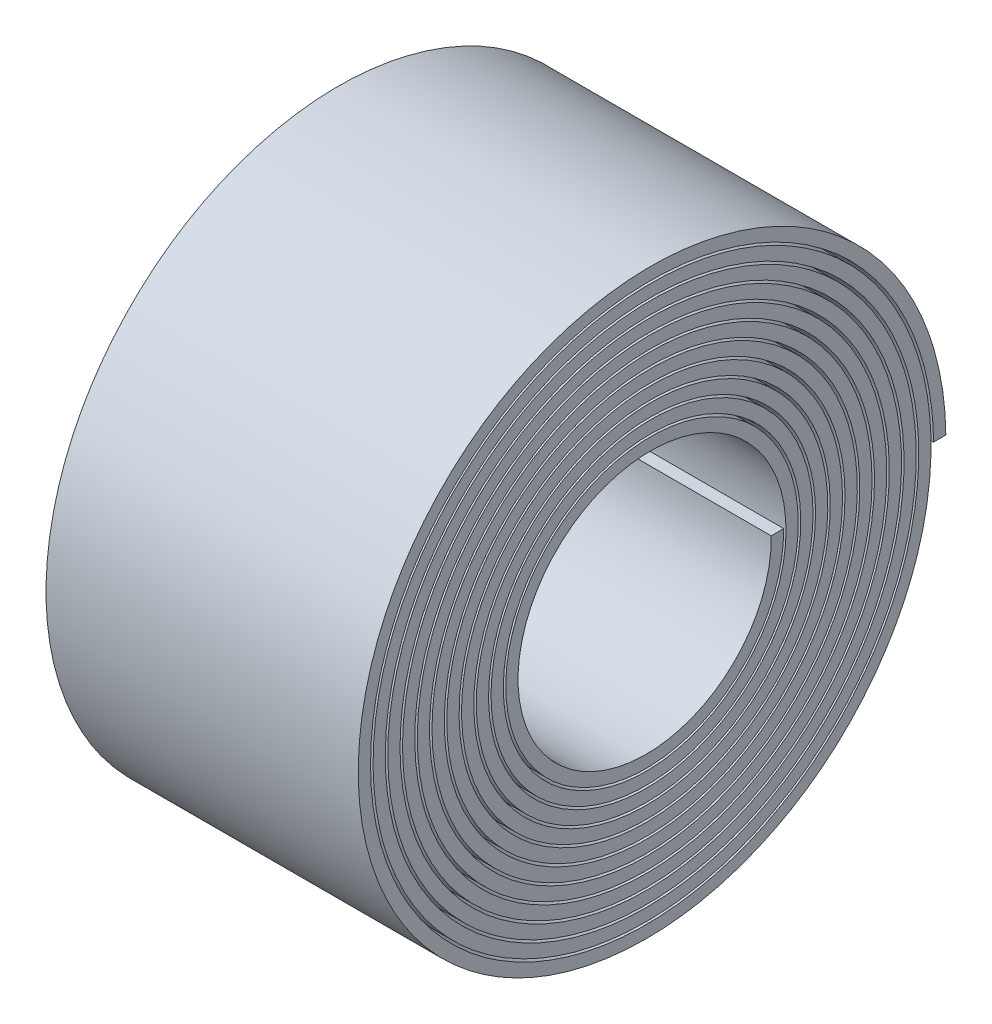
from build123d import *

# Parameters (mm, degrees)
BOSS_EXTRUDE1_DEPTH = 3.175


with BuildPart() as part:
    # Sketch2 → Boss-Extrude1 (new, symmetric)
    with BuildSketch(Plane(origin=(0, 0, 0), x_dir=(0, 0, -1), z_dir=(1, 0, 0))):
        with BuildLine():
            Line((2.5, 0), (2.749954418, 0.004773778))
            add(Edge.make_bspline(
                [(2.749954418, 0.004773778), (2.759336951, -0.48649449), (2.504441518, -1.49123814), (1.394996425, -2.588690616), (-0.135916177, -2.965083795), (-1.655956227, -2.495708999), (-2.727914335, -1.300873713), (-3.035519366, 0.28933995), (-2.476614565, 1.824900774), (-1.196392731, 2.863526826), (0.449981164, 3.097963521), (1.995836502, 2.446770063), (2.995274656, 1.081678084), (3.151763663, -0.617413361), (2.405970813, -2.168109448), (0.956857528, -3.122477136), (-0.791164244, -3.196405729), (-2.341050362, -2.354019812), (-3.244457235, -0.822109443), (-3.231401579, 0.970729687), (-2.290759689, 2.513973532), (-0.677654466, 3.360545026), (1.155572943, 3.256290861), (2.686179686, 2.216073833), (3.470080052, 0.523755196), (3.270643075, -1.345126187), (2.129887327, -2.856958359), (0.360715774, -3.572413849), (-1.538792178, -3.274059512), (-3.025590321, -2.032167742), (-3.666912438, -0.188881321), (-3.2661751, 1.735946036), (-1.922925808, 3.191350059), (-0.008637217, 3.75295879), (1.935937129, 3.24666015), (3.35350829, 1.802215927), (3.829955261, -0.179591752), (3.215221994, -2.138091067), (1.670136557, -3.511334524), (-0.37534239, -3.89732597), (-2.341711784, -3.171606518), (-3.664099638, -1.526830437), (-3.954519139, 0.578114232), (-3.11559957, 2.546083725), (-1.372484672, 3.811078479), (0.787370812, 4.001009357), (2.750474108, 3.047028251), (3.951552473, 1.207330669), (4.036299789, -1.002541074), (2.965762075, -2.954135271), (1.031643916, -4.084812236), (-1.223020906, -4.0599243), (-3.156307086, -2.871714002), (-4.210160179, -0.845743621), (-4.071449499, 1.448174798), (-2.76484133, 3.356219443), (-0.649992191, 4.326913095), (1.677337625, 4.070476695), (3.553094782, 2.64514645), (4.434404729, 0.444794572), (4.05664375, -1.909816545), (2.512677458, -3.746150688), (0.230597435, -4.531988309), (-2.144893002, -4.029626836), (-3.934602507, -2.367528618), (-4.619039038, -0.007888212), (-3.989142073, 2.381824844), (-2.209840682, 4.117666018), (0.222806, 4.694956546), (2.619848529, 3.934947059), (4.294560109, 2.039801055), (4.75916727, -0.460919691), (3.866842273, -2.85818143), (1.857643808, -4.464509483), (-0.705850321, -4.811126786), (-3.096024222, -3.784672353), (-4.626747366, -1.663649539), (-4.850322054, 0.956959836), (-3.688327241, 3.332563352), (-1.458145082, 4.780518217), (1.213576324, 4.876273595), (3.566973576, 3.577743191), (4.925080422, 1.241503056), (4.888537569, -1.474995794), (3.452903638, -3.798420564), (1.014141266, -5.05970898), (-1.740484073, -4.886707769), (-4.026063556, -3.313839921), (-5.183698158, -0.776521949), (-4.870417504, 2.009278831), (-3.160631856, 4.249058072), (-0.529150866, 5.296364106), (2.280591709, 4.839341379), (4.466558659, 2.993408159), (5.397047434, 0.272576245), (4.793196957, -2.553610557), (2.812346721, -4.677721669), (0.007387578, -5.485115738), (-2.827501773, -4.731746305), (-4.881708061, -2.617674715), (-5.55996606, 0.265785729), (-4.654797401, 3.101412732), (-2.40966856, 5.077686219), (0.546275853, 5.621027285), (3.374474307, 4.562205424), (5.264834777, 2.188653714), (5.667762455, -0.83337818), (4.453873895, -3.645803464), (1.95500432, -5.442345433), (-1.126353075, -5.699671007), (-3.914505933, -4.329755682), (-5.609425763, -1.709142681), (-5.716290907, 1.424427775), (-4.189853854, 4.179678939), (-1.451538586, 5.765302005), (1.726798416, 5.717200699), (4.440413996, 4.034222389), (5.909221822, 1.182708467), (5.702021434, -2.03263216), (3.862966725, -4.69579979), (0.903214427, -6.04045683), (-2.341069512, -5.670419181), (-4.94492483, -3.676241592), (-6.158306134, -0.613672639), (-5.62210354, 2.651262328), (-3.474263132, 5.186747355), (-0.314707707, 6.262595306), (2.962210801, 5.554976753), (5.420715824, 3.264222479), (6.041154731, 1.075507272), (6.049991529, 0.002057968)],
                knots=[0, 0, 0, 0, 0.0078125, 0.015625, 0.0234375, 0.03125, 0.0390625, 0.046875, 0.0546875, 0.0625, 0.0703125, 0.078125, 0.0859375, 0.09375, 0.1015625, 0.109375, 0.1171875, 0.125, 0.1328125, 0.140625, 0.1484375, 0.15625, 0.1640625, 0.171875, 0.1796875, 0.1875, 0.1953125, 0.203125, 0.2109375, 0.21875, 0.2265625, 0.234375, 0.2421875, 0.25, 0.2578125, 0.265625, 0.2734375, 0.28125, 0.2890625, 0.296875, 0.3046875, 0.3125, 0.3203125, 0.328125, 0.3359375, 0.34375, 0.3515625, 0.359375, 0.3671875, 0.375, 0.3828125, 0.390625, 0.3984375, 0.40625, 0.4140625, 0.421875, 0.4296875, 0.4375, 0.4453125, 0.453125, 0.4609375, 0.46875, 0.4765625, 0.484375, 0.4921875, 0.5, 0.5078125, 0.515625, 0.5234375, 0.53125, 0.5390625, 0.546875, 0.5546875, 0.5625, 0.5703125, 0.578125, 0.5859375, 0.59375, 0.6015625, 0.609375, 0.6171875, 0.625, 0.6328125, 0.640625, 0.6484375, 0.65625, 0.6640625, 0.671875, 0.6796875, 0.6875, 0.6953125, 0.703125, 0.7109375, 0.71875, 0.7265625, 0.734375, 0.7421875, 0.75, 0.7578125, 0.765625, 0.7734375, 0.78125, 0.7890625, 0.796875, 0.8046875, 0.8125, 0.8203125, 0.828125, 0.8359375, 0.84375, 0.8515625, 0.859375, 0.8671875, 0.875, 0.8828125, 0.890625, 0.8984375, 0.90625, 0.9140625, 0.921875, 0.9296875, 0.9375, 0.9453125, 0.953125, 0.9609375, 0.96875, 0.9765625, 0.984375, 0.9921875, 1, 1, 1, 1], degree=3))
            Line((6.049991529, 0.002057968), (5.8, 0))
            add(Edge.make_bspline(
                [(2.5, 0), (2.50859375, -0.449967698), (2.392778951, -0.904162722), (1.940090731, -1.692859421), (1.603767996, -2.026210074), (0.801828477, -2.474344378), (0.337287211, -2.588417762), (-0.590215738, -2.560060692), (-1.051876817, -2.417574583), (-1.840560709, -1.911264086), (-2.166428561, -1.548067808), (-2.586577644, -0.699936707), (-2.680185601, -0.216146124), (-2.603623307, 0.736555878), (-2.433465098, 1.204126814), (-1.872480277, 1.989379926), (-1.482360865, 2.305908109), (-0.588913213, 2.69458986), (-0.08679681, 2.766112225), (0.888541293, 2.638810049), (1.360386236, 2.440069018), (2.138689222, 1.823566764), (2.443999289, 1.406593191), (2.797753061, 0.46893579), (2.845612679, -0.050470062), (2.665174615, -1.045693685), (2.437035486, -1.520102303), (1.764388942, -2.287846833), (1.320750679, -2.580045979), (0.340221958, -2.895447005), (-0.195326178, -2.918116917), (-1.207504704, -2.682297896), (-1.682697681, -2.424045921), (-2.436199319, -1.694851079), (-2.713387723, -1.224859604), (-2.987061564, -0.203028609), (-2.983072087, 0.347406368), (-2.689789841, 1.373437484), (-2.400815567, 1.847572344), (-1.614897121, 2.583083839), (-1.118986989, 2.843362124), (-0.057651516, 3.071999099), (0.506309518, 3.039944774), (1.542928293, 2.687291235), (2.014105516, 2.367094939), (2.727830484, 1.524511364), (2.969307263, 1.003240842), (3.149676804, -0.095575298), (3.088223193, -0.671599626), (2.674475391, -1.715388283), (2.322671166, -2.181657707), (1.423718991, -2.869764659), (0.877770249, -3.090564131), (-0.256280318, -3.219529026), (-0.842806976, -3.127419324), (-1.890205347, -2.651049735), (-2.349572831, -2.267369207), (-3.008209483, -1.312586482), (-3.206479077, -0.742765327), (-3.281009534, 0.424055448), (-3.157070986, 1.019429447), (-2.616757292, 2.066746065), (-2.201052955, 2.517180389), (-1.191221871, 3.142488237), (-0.598457038, 3.31640625), (0.598457038, 3.33359375), (1.200933931, 3.176743831), (2.244357741, 2.571378057), (2.683797727, 2.12362621), (3.271926812, 1.059774878), (3.41971004, 0.445116858), (3.376780916, -0.779007048), (3.186033271, -1.386757885), (2.514730258, -2.422370525), (2.035033534, -2.848732354), (0.918436885, -3.395856184), (0.283056306, -3.515767501), (-0.965194342, -3.410096206), (-1.576310983, -3.184566309), (-2.600099609, -2.446671494), (-3.011284313, -1.935260959), (-3.513614885, -0.767440782), (-3.603970757, -0.112626336), (-3.433092758, 1.156476102), (-3.172003282, 1.768976884), (-2.367099748, 2.776847493), (-1.824336577, 3.170748591), (-0.607060662, 3.624551467), (0.065783418, 3.683729369), (1.35227936, 3.445353638), (1.964115097, 3.148039511), (2.951906315, 2.275954274), (3.326417576, 1.702330977), (3.728026962, 0.437611378), (3.754472668, -0.251745526), (3.446493714, -1.552002653), (3.112406835, -2.161062956), (2.173216354, -3.124560233), (1.569357553, -3.47758354), (0.259447957, -3.823417314), (-0.444795788, -3.815652044), (-1.755017782, -3.436161437), (-2.359137676, -3.064875048), (-3.294087863, -2.058909915), (-3.623541147, -1.425572664), (-3.910115788, -0.072964872), (-3.86674318, 0.64443439), (-3.414040536, 1.960671679), (-3.005253211, 2.557638499), (-1.933102011, 3.459764748), (-1.271175651, 3.763589972), (0.121404823, 3.987535336), (0.850127195, 3.907248218), (2.168288377, 3.379851595), (2.755848924, 2.933390849), (3.620865869, 1.795903161), (3.89703703, 1.106408713), (4.055110926, -0.323190501), (3.936697865, -1.061307155), (3.333353528, -2.377171073), (2.849179024, -2.953039004), (1.64746755, -3.776668171), (0.931556637, -4.023199302), (-0.531885095, -4.112301812), (-1.277375848, -3.954653419), (-2.586604279, -3.274344944), (-3.148467714, -2.752551274), (-3.926453117, -1.48799308), (-4.14140625, -0.746946378), (-4.15859375, 0.746946378), (-3.960708712, 1.497705139), (-3.202665383, 2.79585606), (-2.643484425, 3.341385379), (-1.317721279, 4.069509245), (-0.552946505, 4.251002317), (0.967798358, 4.193501141), (1.721638953, 3.954491958), (3.004180341, 3.118196431), (3.531036148, 2.521999259), (4.205134725, 1.136937064), (4.351349401, 0.349966489), (4.216569105, -1.193832807), (3.935667519, -1.948495153), (3.020862711, -3.210819292), (2.388161053, -3.716660517), (0.945968352, -4.33263991), (0.138455862, -4.441829289), (-1.424410911, -4.227375468), (-2.177567531, -3.903937546), (-3.415005765, -2.910632731), (-3.897497893, -2.242079963), (-4.451349873, -0.745185534), (-4.521846058, 0.081096774), (-4.225532661, 1.658865035), (-3.859043536, 2.408127891), (-2.787519606, 3.615965796), (-2.083911275, 4.072789173), (-0.535000798, 4.560606919), (0.308164873, 4.590828418), (1.49941667, 4.305724253), (1.884131855, 4.156627271), (2.600856618, 3.760484593), (2.93280146, 3.513471219), (3.519547918, 2.938878159), (3.774295618, 2.611347035), (4.187680107, 1.899056501), (4.346277784, 1.514358453), (4.555274638, 0.715364354), (4.605652435, 0.301138071), (4.593919741, -0.526974892), (4.53180726, -0.940788425), (4.298957776, -1.737994862), (4.128238423, -2.12131654), (3.689957264, -2.829501279), (3.422431574, -3.154300228), (2.809425664, -3.721494668), (2.463997503, -3.963837864), (1.719846675, -4.348032957), (1.321188311, -4.489848247), (0.499248256, -4.662104401), (0.076038503, -4.692527095), (-0.764384423, -4.639150874), (-1.181523213, -4.555353649), (-1.979451115, -4.278977775), (-2.360168796, -4.086420663), (-3.057376555, -3.6059027), (-3.373803366, -3.317981776), (-3.91906713, -2.667122364), (-4.147853629, -2.304239388), (-4.500713505, -1.529406762), (-4.624752978, -1.117524257), (-4.758513572, -0.274351853), (-4.768219894, 0.156864089), (-4.671966305, 1.007471826), (-4.566011882, 1.426788191), (-4.24548916, 2.223055045), (-4.030946346, 2.59993411), (-3.508232263, 3.283698625), (-3.200104731, 3.590521875), (-2.512093131, 4.111485344), (-2.13226797, 4.32557716), (-1.328066573, 4.645002821), (-0.903760212, 4.750305654), (-0.041186282, 4.843897102), (0.39700547, 4.832174445), (1.2555816, 4.691919515), (1.6758897, 4.563396635), (2.468054433, 4.198237092), (2.83983987, 3.961629916), (3.507673406, 3.396901992), (3.803660597, 3.068828785), (4.297971438, 2.344508673), (4.496248951, 1.948324002), (4.780196282, 1.116199563), (4.865838168, 0.680332274), (4.917675449, -0.19969907), (4.883863247, -0.643785619), (4.698598845, -1.508028201), (4.547160039, -1.92810731), (4.137008411, -2.713677433), (3.87832911, -3.0790977), (3.27191338, -3.728499069), (2.924228267, -4.01242078), (2.164585615, -4.477752258), (1.752693549, -4.659118368), (0.894222199, -4.905606135), (0.447717859, -4.970703125), (-0.447717859, -4.979296875), (-0.896570224, -4.922789849), (-1.764097902, -4.691629357), (-2.182695856, -4.516993371), (-2.959134872, -4.06163293), (-3.316905863, -3.780946058), (-3.945368598, -3.133314013), (-4.216002694, -2.7664239), (-4.650062017, -1.97258642), (-4.813446273, -1.545707676), (-5.020564024, -0.662593183), (-5.064276288, -0.206434697), (-5.028239673, 0.702248213), (-4.94849095, 1.154692305), (-4.670674611, 2.023050764), (-4.472628635, 2.438887555), (-3.971984614, 3.203622624), (-3.669428229, 3.552451737), (-2.98119807, 4.157472401), (-2.595583049, 4.413608272), (-1.768819178, 4.814144934), (-1.327741987, 4.958507645), (-0.42181253, 5.124423478), (0.042960314, 5.145958977), (0.962634285, 5.064014328), (1.417453963, 4.960538399), (2.284122721, 4.635438318), (2.695894236, 4.413840029), (3.446324062, 3.867982628), (3.78491435, 3.543769251), (4.36400095, 2.815706667), (4.604443775, 2.41191984), (4.969257881, 1.553637227), (5.093594174, 1.099216018), (5.216562366, 0.172420504), (5.21518041, -0.299872389), (5.086165588, -1.228187943), (4.958541111, -1.684128243), (4.585665893, -2.546527756), (4.340445287, -2.952909643), (3.749592239, -3.686412572), (3.404009595, -4.013466969), (2.637028064, -4.56414745), (2.215695113, -4.787722466), (1.327438642, -5.114673008), (0.860592481, -5.218016832), (-0.085003586, -5.296385287), (-0.563670276, -5.271399982), (-1.498190565, -5.09427445), (-1.953961111, -4.942146884), (-2.809460171, -4.521145889), (-3.209111833, -4.252306905), (-3.92305413, -3.616825594), (-4.237279732, -3.250237099), (-4.757110529, -2.445397719), (-4.962667296, -2.007216234), (-5.249680349, -1.090665556), (-5.331108412, -0.612376362), (-5.363325904, 0.349842735), (-5.314109463, 0.833687804), (-5.087960053, 1.771894969), (-4.911044102, 2.226173541), (-4.441711297, 3.072096948), (-4.149333223, 3.463665645), (-3.469742344, 4.155409922), (-3.082587365, 4.455522321), (-2.241098188, 4.942096938), (-1.786836752, 5.128513585), (-0.843803352, 5.373590405), (-0.355113867, 5.432226015), (0.621443715, 5.416849211), (1.109225565, 5.342835127), (2.04852744, 5.066881463), (2.499963702, 4.864963336), (3.333600189, 4.347240734), (3.715725234, 4.031479384), (4.382639019, 3.30845013), (4.667366668, 2.901243994), (5.118324251, 2.024458878), (5.284511687, 1.554955907), (5.485736674, 0.587379692), (5.520753498, 0.089391239), (5.456453724, -0.899118689), (5.357139779, -1.389552713), (5.030739353, -2.327289872), (4.803678823, -2.774509239), (4.237659482, -3.593119627), (3.898748142, -3.964436669), (3.133104917, -4.603901075), (2.706438673, -4.87198967), (1.795855644, -5.285023561), (1.312017982, -5.429929643), (0.321963411, -5.585478148), (-0.18416658, -5.59610385), (-1.182146948, -5.48167358), (-1.673908892, -5.356624701), (-2.607362008, -4.979277569), (-3.048969652, -4.727009816), (-3.849795207, -4.1129404), (-4.208940591, -3.751190536), (-4.818359056, -2.943911179), (-5.068575931, -2.498451117), (-5.441442168, -1.555710236), (-5.564055803, -1.058511514), (-5.672201752, -0.048163261), (-5.657721509, 0.464897415), (-5.492080561, 1.469776772), (-5.340931488, 1.961506265), (-4.912284572, 2.887903771), (-4.634821816, 3.322488744), (-3.973104688, 4.102759723), (-3.588906414, 4.448374899), (-2.741121928, 5.025181997), (-2.277608844, 5.256320503), (-1.304489593, 5.586846228), (-0.794968345, 5.686201406), (0.233373478, 5.745324714), (0.752103459, 5.705084603), (1.761227407, 5.487286003), (2.251531665, 5.309743777), (3.168057694, 4.829594759), (3.594197163, 4.527027664), (4.351141504, 3.818222513), (4.681877494, 3.412044809), (5.22354775, 2.525038601), (5.434431621, 2.04428681), (5.72052339, 1.042704988), (5.795703125, 0.521962529), (5.8, 0)],
                knots=[0, 0, 0, 0, 0.0078125, 0.0078125, 0.015625, 0.015625, 0.0234375, 0.0234375, 0.03125, 0.03125, 0.0390625, 0.0390625, 0.046875, 0.046875, 0.0546875, 0.0546875, 0.0625, 0.0625, 0.0703125, 0.0703125, 0.078125, 0.078125, 0.0859375, 0.0859375, 0.09375, 0.09375, 0.1015625, 0.1015625, 0.109375, 0.109375, 0.1171875, 0.1171875, 0.125, 0.125, 0.1328125, 0.1328125, 0.140625, 0.140625, 0.1484375, 0.1484375, 0.15625, 0.15625, 0.1640625, 0.1640625, 0.171875, 0.171875, 0.1796875, 0.1796875, 0.1875, 0.1875, 0.1953125, 0.1953125, 0.203125, 0.203125, 0.2109375, 0.2109375, 0.21875, 0.21875, 0.2265625, 0.2265625, 0.234375, 0.234375, 0.2421875, 0.2421875, 0.25, 0.25, 0.2578125, 0.2578125, 0.265625, 0.265625, 0.2734375, 0.2734375, 0.28125, 0.28125, 0.2890625, 0.2890625, 0.296875, 0.296875, 0.3046875, 0.3046875, 0.3125, 0.3125, 0.3203125, 0.3203125, 0.328125, 0.328125, 0.3359375, 0.3359375, 0.34375, 0.34375, 0.3515625, 0.3515625, 0.359375, 0.359375, 0.3671875, 0.3671875, 0.375, 0.375, 0.3828125, 0.3828125, 0.390625, 0.390625, 0.3984375, 0.3984375, 0.40625, 0.40625, 0.4140625, 0.4140625, 0.421875, 0.421875, 0.4296875, 0.4296875, 0.4375, 0.4375, 0.4453125, 0.4453125, 0.453125, 0.453125, 0.4609375, 0.4609375, 0.46875, 0.46875, 0.4765625, 0.4765625, 0.484375, 0.484375, 0.4921875, 0.4921875, 0.5, 0.5, 0.5078125, 0.5078125, 0.515625, 0.515625, 0.5234375, 0.5234375, 0.53125, 0.53125, 0.5390625, 0.5390625, 0.546875, 0.546875, 0.5546875, 0.5546875, 0.5625, 0.5625, 0.5703125, 0.5703125, 0.578125, 0.578125, 0.5859375, 0.5859375, 0.59375, 0.59375, 0.6015625, 0.6015625, 0.609375, 0.609375, 0.6171875, 0.6171875, 0.62109375, 0.62109375, 0.625, 0.625, 0.62890625, 0.62890625, 0.6328125, 0.6328125, 0.63671875, 0.63671875, 0.640625, 0.640625, 0.64453125, 0.64453125, 0.6484375, 0.6484375, 0.65234375, 0.65234375, 0.65625, 0.65625, 0.66015625, 0.66015625, 0.6640625, 0.6640625, 0.66796875, 0.66796875, 0.671875, 0.671875, 0.67578125, 0.67578125, 0.6796875, 0.6796875, 0.68359375, 0.68359375, 0.6875, 0.6875, 0.69140625, 0.69140625, 0.6953125, 0.6953125, 0.69921875, 0.69921875, 0.703125, 0.703125, 0.70703125, 0.70703125, 0.7109375, 0.7109375, 0.71484375, 0.71484375, 0.71875, 0.71875, 0.72265625, 0.72265625, 0.7265625, 0.7265625, 0.73046875, 0.73046875, 0.734375, 0.734375, 0.73828125, 0.73828125, 0.7421875, 0.7421875, 0.74609375, 0.74609375, 0.75, 0.75, 0.75390625, 0.75390625, 0.7578125, 0.7578125, 0.76171875, 0.76171875, 0.765625, 0.765625, 0.76953125, 0.76953125, 0.7734375, 0.7734375, 0.77734375, 0.77734375, 0.78125, 0.78125, 0.78515625, 0.78515625, 0.7890625, 0.7890625, 0.79296875, 0.79296875, 0.796875, 0.796875, 0.80078125, 0.80078125, 0.8046875, 0.8046875, 0.80859375, 0.80859375, 0.8125, 0.8125, 0.81640625, 0.81640625, 0.8203125, 0.8203125, 0.82421875, 0.82421875, 0.828125, 0.828125, 0.83203125, 0.83203125, 0.8359375, 0.8359375, 0.83984375, 0.83984375, 0.84375, 0.84375, 0.84765625, 0.84765625, 0.8515625, 0.8515625, 0.85546875, 0.85546875, 0.859375, 0.859375, 0.86328125, 0.86328125, 0.8671875, 0.8671875, 0.87109375, 0.87109375, 0.875, 0.875, 0.87890625, 0.87890625, 0.8828125, 0.8828125, 0.88671875, 0.88671875, 0.890625, 0.890625, 0.89453125, 0.89453125, 0.8984375, 0.8984375, 0.90234375, 0.90234375, 0.90625, 0.90625, 0.91015625, 0.91015625, 0.9140625, 0.9140625, 0.91796875, 0.91796875, 0.921875, 0.921875, 0.92578125, 0.92578125, 0.9296875, 0.9296875, 0.93359375, 0.93359375, 0.9375, 0.9375, 0.94140625, 0.94140625, 0.9453125, 0.9453125, 0.94921875, 0.94921875, 0.953125, 0.953125, 0.95703125, 0.95703125, 0.9609375, 0.9609375, 0.96484375, 0.96484375, 0.96875, 0.96875, 0.97265625, 0.97265625, 0.9765625, 0.9765625, 0.98046875, 0.98046875, 0.984375, 0.984375, 0.98828125, 0.98828125, 0.9921875, 0.9921875, 0.99609375, 0.99609375, 1, 1, 1, 1], degree=3))
        make_face()
    extrude(amount=BOSS_EXTRUDE1_DEPTH, both=True)


solid = part.part
